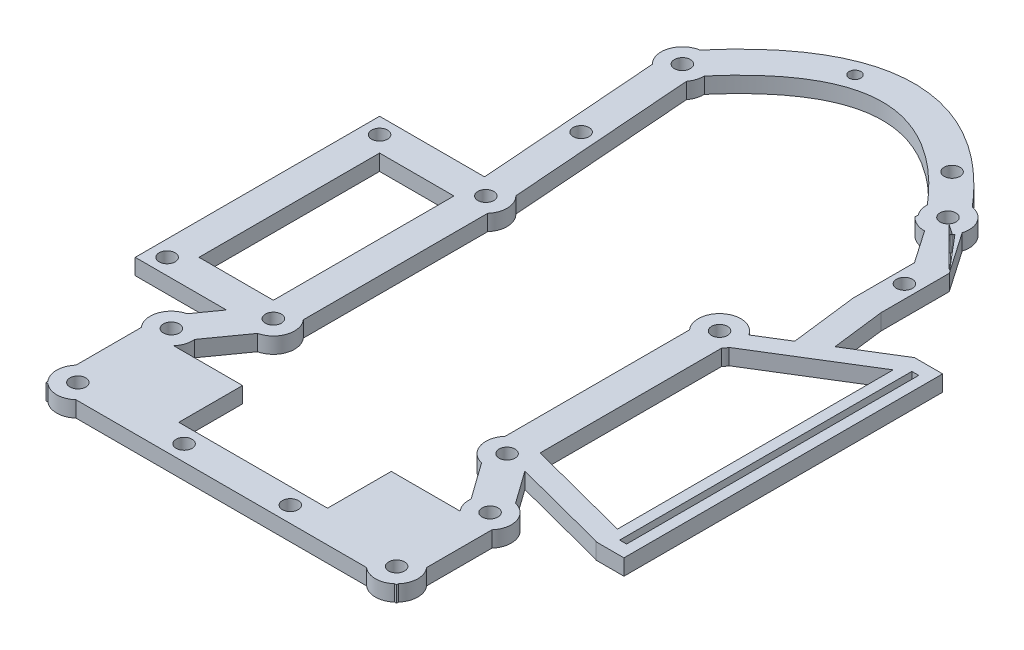
from build123d import *

# Parameters (mm, degrees)
SKETCH_1_W           = 80
SKETCH_1_H           = 120
SKETCH_1_R           = 1.5
EXTRUDE_1_DEPTH      = 3
SKETCH_2_W           = 10
SKETCH_2_H           = 60
SKETCH_2_W_2         = 1.3
SKETCH_2_H_2         = 55
EXTRUDE_2_DEPTH      = 3
CUT_EXTRUDE_1_DEPTH  = 126.435242257
EXTRUDE_4_DEPTH      = 3
EXTRUDE_START        = -3
EXTRUDE_7_DEPTH      = 3
CUT_EXTRUDE_5_DEPTH  = 124.421392121
SKETCH_20_W          = 13
SKETCH_20_H          = 12
EXTRUDE_8_DEPTH      = 3
CUT_EXTRUDE_6_DEPTH  = 124.421392121
SKETCH_23_R          = 1.5
EXTRUDE_9_DEPTH      = 3
SKETCH_24_R          = 1.5
CUT_EXTRUDE_7_DEPTH  = 124.421392121
SKETCH_25_R          = 1.5
CUT_EXTRUDE_8_DEPTH  = 124.421392121
SKETCH_26_R          = 1.5
CUT_EXTRUDE_9_DEPTH  = 124.421392121
SKETCH_27_R          = 1.1
CUT_EXTRUDE_10_DEPTH = 124.421392121


# Read off the part's stored shape, not the designer's step: 凸台-拉伸7
with BuildPart() as part:
    # 草图1 → 凸台-拉伸1 (new body)
    with BuildSketch(Plane(origin=(0, 0, 0), x_dir=(1, 0, 0), z_dir=(0, 1, 0))):
        with Locations((0, -55)):
            Rectangle(SKETCH_1_W, SKETCH_1_H)
        with Locations(Location((-25, 0, 0), (0, 0, 270))):
            Circle(SKETCH_1_R, mode=Mode.SUBTRACT)
        with Locations(Location((25, 0, 0), (0, 0, 270))):
            Circle(SKETCH_1_R, mode=Mode.SUBTRACT)
        with Locations(Location((-30, -91.2, 0), (0, 0, 270))):
            Circle(SKETCH_1_R, mode=Mode.SUBTRACT)
        with Locations(Location((-30, -108.8, 0), (0, 0, 270))):
            Circle(SKETCH_1_R, mode=Mode.SUBTRACT)
        with Locations(Location((30, -108.8, 0), (0, 0, 270))):
            Circle(SKETCH_1_R, mode=Mode.SUBTRACT)
        with Locations(Location((30, -91.2, 0), (0, 0, 270))):
            Circle(SKETCH_1_R, mode=Mode.SUBTRACT)
        with Locations(Location((-22, -40, 0), (0, 0, 270))):
            Circle(SKETCH_1_R, mode=Mode.SUBTRACT)
        with Locations(Location((-22, -80, 0), (0, 0, 270))):
            Circle(SKETCH_1_R, mode=Mode.SUBTRACT)
        with Locations(Location((22, -40, 0), (0, 0, 270))):
            Circle(SKETCH_1_R, mode=Mode.SUBTRACT)
        with Locations(Location((22, -80, 0), (0, 0, 270))):
            Circle(SKETCH_1_R, mode=Mode.SUBTRACT)
    extrude(amount=EXTRUDE_1_DEPTH)

    # 草图2 → 凸台-拉伸2 (add)
    with BuildSketch(Plane(origin=(0, 3, 0), x_dir=(1, 0, 0), z_dir=(0, 1, 0))):
        with Locations((45, -56)):
            Rectangle(SKETCH_2_W, SKETCH_2_H)
        with Locations((47.35, -56)):
            Rectangle(SKETCH_2_W_2, SKETCH_2_H_2, mode=Mode.SUBTRACT)
    extrude(amount=-EXTRUDE_2_DEPTH)

    # 草图6 → 切除-拉伸1 (cut, through all)
    with BuildSketch(Plane(origin=(0, 3, 0), x_dir=(1, 0, 0), z_dir=(0, 1, 0))):
        with BuildLine():
            Line((-25.189473533, -37.586028463), (-27.793722326, -2.862711226))
            ThreePointArc((-27.793722326, -2.862711226), (-26.553240274, 3.686115117), (-21, 0))
            ThreePointArc((-21, 0), (-21.20804179, -1.27320577), (-21.810526467, -2.413971537))
            Line((-21.810526467, -2.413971537), (-19.206277674, -37.137288774))
            ThreePointArc((-19.206277674, -37.137288774), (-18.313884883, -38.446759726), (-18, -40))
            ThreePointArc((-18, -40), (-18.258342613, -41.414213562), (-19, -42.645751311))
            Line((-19, -42.645751311), (-19, -77.354248689))
            ThreePointArc((-19, -77.354248689), (-18.258342613, -78.585786438), (-18, -80))
            ThreePointArc((-18, -80), (-18.868422538, -82.488618613), (-21.096611299, -83.896650979))
            Line((-21.096611299, -83.896650979), (-26.020987873, -90.790778183))
            ThreePointArc((-26.020987873, -90.790778183), (-26.005250414, -90.995120165), (-26, -91.2))
            ThreePointArc((-26, -91.2), (-26.258342613, -92.614213562), (-27, -93.845751311))
            Line((-27, -93.845751311), (-27, -105.8))
            Line((-27, -105.8), (27, -105.8))
            Line((27, -105.8), (27, -93.845751311))
            ThreePointArc((27, -93.845751311), (26.190817966, -92.420709724), (26.020987873, -90.790778183))
            Line((26.020987873, -90.790778183), (21.096611299, -83.896650979))
            ThreePointArc((21.096611299, -83.896650979), (18.190817966, -81.220709724), (19, -77.354248689))
            Line((19, -77.354248689), (19, -42.645751311))
            ThreePointArc((19, -42.645751311), (18.002801671, -39.850315262), (19.206277674, -37.137288774))
            Line((19.206277674, -37.137288774), (21.810526467, -2.413971537))
            ThreePointArc((21.810526467, -2.413971537), (23.72679423, 3.79195821), (29, 0))
            ThreePointArc((29, 0), (28.686115117, -1.553240274), (27.793722326, -2.862711226))
            Line((27.793722326, -2.862711226), (25.189473533, -37.586028463))
            ThreePointArc((25.189473533, -37.586028463), (25.300764223, -37.740585133), (25.404571796, -37.900264091))
            Line((25.404571796, -37.900264091), (44.7, -26))
            Line((44.7, -26), (40, -26))
            Line((40, -26), (40, 5))
            Line((40, 5), (-40, 5))
            Line((-40, 5), (-40, -115))
            Line((-40, -115), (40, -115))
            Line((40, -115), (40, -86))
            Line((40, -86), (44.7, -86))
            Line((44.7, -86), (44.7, -85.92173913))
            Line((44.7, -85.92173913), (26.530995751, -81.181998892))
            Line((26.530995751, -81.181998892), (30.903388701, -87.303349021))
            ThreePointArc((30.903388701, -87.303349021), (33.131577462, -88.711381387), (34, -91.2))
            ThreePointArc((34, -91.2), (33.741657387, -92.614213562), (33, -93.845751311))
            Line((33, -93.845751311), (33, -106.154248689))
            ThreePointArc((33, -106.154248689), (33.741657387, -107.385786438), (34, -108.8))
            ThreePointArc((34, -108.8), (33.741657387, -110.214213562), (33, -111.445751311))
            Line((33, -111.445751311), (33, -111.8))
            Line((33, -111.8), (32.645751311, -111.8))
            ThreePointArc((32.645751311, -111.8), (30, -112.8), (27.354248689, -111.8))
            Line((27.354248689, -111.8), (-27.354248689, -111.8))
            ThreePointArc((-27.354248689, -111.8), (-30, -112.8), (-32.645751311, -111.8))
            Line((-32.645751311, -111.8), (-33, -111.8))
            Line((-33, -111.8), (-33, -111.445751311))
            ThreePointArc((-33, -111.445751311), (-34, -108.8), (-33, -106.154248689))
            Line((-33, -106.154248689), (-33, -93.845751311))
            ThreePointArc((-33, -93.845751311), (-33.809182034, -89.979290276), (-30.903388701, -87.303349021))
            Line((-30.903388701, -87.303349021), (-25.979012127, -80.409221817))
            ThreePointArc((-25.979012127, -80.409221817), (-25.809182034, -78.779290276), (-25, -77.354248689))
            Line((-25, -77.354248689), (-25, -42.645751311))
            ThreePointArc((-25, -42.645751311), (-25.997198329, -40.149684738), (-25.189473533, -37.586028463))
        make_face()
        with BuildLine():
            Line((25, -76.782608696), (44.7, -81.92173913))
            Line((44.7, -81.92173913), (44.7, -30))
            Line((44.7, -30), (25.574350827, -41.795554556))
            ThreePointArc((25.574350827, -41.795554556), (25.31454836, -42.239144741), (25, -42.645751311))
            Line((25, -42.645751311), (25, -76.782608696))
        make_face()
    extrude(amount=-CUT_EXTRUDE_1_DEPTH, mode=Mode.SUBTRACT)

    # 草图8 → 凸台-拉伸4 (add)
    with BuildSketch(Plane(origin=(0, 3, 0), x_dir=(1, 0, 0), z_dir=(0, 1, 0))):
        with BuildLine():
            ThreePointArc((21.001994681, 0.126307052), (22.453984731, 3.085094204), (25.63451173, 3.949353727))
            add(Edge.make_bspline(
                [(-25.63451173, 3.949353727), (-21.616035979, 8.660307293), (-14.12462472, 14.545430623), (-7.175762049, 17.826043655), (0, 18.957143354), (7.175762049, 17.826043655), (14.12462472, 14.545430623), (21.616035979, 8.660307293), (25.63451173, 3.949353727)],
                knots=[0.032998994, 0.032998994, 0.032998994, 0.1875, 0.3125, 0.4375, 0.5625, 0.6875, 0.8125, 0.967001006, 0.967001006, 0.967001006], degree=2))
            ThreePointArc((-25.63451173, 3.949353727), (-22.453984731, 3.085094204), (-21.001994681, 0.126307052))
            add(Edge.make_bspline(
                [(-21.001994681, 0.126307052), (-17.328264465, 4.412597994), (-10.87537528, 9.455946034), (-5.324237951, 12.053221163), (0, 12.881417518), (5.324237951, 12.053221163), (10.87537528, 9.455946034), (17.328264465, 4.412597994), (21.001994681, 0.126307052)],
                knots=[0.034324579, 0.034324579, 0.034324579, 0.1875, 0.3125, 0.4375, 0.5625, 0.6875, 0.8125, 0.965675421, 0.965675421, 0.965675421], degree=2))
        make_face()
    extrude(amount=-EXTRUDE_4_DEPTH)

    # 凸台-拉伸7 outline → 凸台-拉伸7 (add)
    with BuildSketch(Plane.XZ.offset(EXTRUDE_START)):
        with BuildLine():
            ThreePointArc((27.793720423, 2.862736604), (28.42096157, 2.072958417), (28.83072097, 1.151395464))
            Line((28.83072097, 1.151395464), (34.223691018, 8.972202338))
            Line((34.223691018, 8.972202338), (34.223691018, 21.806543087))
            Line((34.223691018, 21.806543087), (35.438742218, 31.711788941))
            Line((35.438742218, 31.711788941), (30.755565173, 34.600091964))
            Line((30.755565173, 34.600091964), (29.223691018, 22.112066665))
            Line((29.223691018, 22.112066665), (29.223691018, 10.528995876))
            Line((29.223691018, 10.528995876), (27.415425056, 7.906674828))
            Line((27.415425056, 7.906674828), (27.793720423, 2.862736604))
        make_face()
    extrude(amount=EXTRUDE_7_DEPTH)

    # 草图17 → 切除-拉伸5 (cut, through all)
    with BuildSketch(Plane.XZ):
        with BuildLine():
            Line((25, 4.403860476), (27.415425056, 7.906674828))
            Line((27.415425056, 7.906674828), (25.189473533, 37.586028463))
            ThreePointArc((25.189473533, 37.586028463), (22.299159793, 36.01120276), (19.206277674, 37.137288774))
            Line((19.206277674, 37.137288774), (21.767281468, 2.990571516))
            ThreePointArc((21.767281468, 2.990571516), (23.235924124, 4.035098933), (25, 4.403860476))
        make_face()
    extrude(amount=-CUT_EXTRUDE_5_DEPTH, mode=Mode.SUBTRACT)

    # 草图20 → 凸台-拉伸8 (add)
    with BuildSketch(Plane(origin=(0, 0, 0), x_dir=(-1, 0, 0), z_dir=(0, -1, 0))):
        with Locations((20.5, -99.8)):
            Rectangle(SKETCH_20_W, SKETCH_20_H)
        with Locations((-20.5, -99.8)):
            Rectangle(SKETCH_20_W, SKETCH_20_H)
    extrude(amount=-EXTRUDE_8_DEPTH)

    # 草图22 → 切除-拉伸6 (cut, through all)
    with BuildSketch(Plane(origin=(0, 3, 0), x_dir=(1, 0, 0), z_dir=(0, 1, 0))):
        with BuildLine():
            ThreePointArc((-6.4, 15.3), (-7, 15.5), (-7.6, 15.3))
            ThreePointArc((-7.6, 15.3), (-7.447213595, 13.605572809), (-6, 14.5))
            ThreePointArc((-6, 14.5), (-6.105572809, 14.947213595), (-6.4, 15.3))
        make_face()
    extrude(amount=-CUT_EXTRUDE_6_DEPTH, mode=Mode.SUBTRACT)

    # 草图23 → 凸台-拉伸9 (add)
    with BuildSketch(Plane(origin=(0, 3, 0), x_dir=(1, 0, 0), z_dir=(0, 1, 0))):
        with BuildLine():
            Line((-25.189473533, -37.586028463), (-25.233425668, -37))
            Line((-25.233425668, -37), (-45, -37))
            Line((-45, -37), (-45, -83))
            Line((-45, -83), (-27.829567972, -83))
            Line((-27.829567972, -83), (-25.979012127, -80.409221817))
            ThreePointArc((-25.979012127, -80.409221817), (-25.809182034, -78.779290276), (-25, -77.354248689))
            Line((-25, -77.354248689), (-25, -77))
            Line((-25, -77), (-39, -77))
            Line((-39, -77), (-39, -43))
            Line((-39, -43), (-25, -43))
            Line((-25, -43), (-25, -42.645751311))
            ThreePointArc((-25, -42.645751311), (-25.997198329, -40.149684738), (-25.189473533, -37.586028463))
        make_face()
        with Locations(Location((-42, -80, 0), (0, 0, 270))):
            Circle(SKETCH_23_R, mode=Mode.SUBTRACT)
        with Locations(Location((-42, -40, 0), (0, 0, 270))):
            Circle(SKETCH_23_R, mode=Mode.SUBTRACT)
    extrude(amount=-EXTRUDE_9_DEPTH)

    # 草图24 → 切除-拉伸7 (cut, through all)
    with BuildSketch(Plane(origin=(0, 3, 0), x_dir=(1, 0, 0), z_dir=(0, 1, 0))):
        with Locations(Location((31.723691018, -14.919604311, 0), (0, 0, 270))):
            Circle(SKETCH_24_R)
    extrude(amount=-CUT_EXTRUDE_7_DEPTH, mode=Mode.SUBTRACT)

    # 草图25 → 切除-拉伸8 (cut, through all)
    with BuildSketch(Plane(origin=(0, 3, 0), x_dir=(1, 0, 0), z_dir=(0, 1, 0))):
        with Locations(Location((-10, -108.8, 0), (0, 0, 270))):
            Circle(SKETCH_25_R)
        with Locations(Location((10, -108.8, 0), (0, 0, 270))):
            Circle(SKETCH_25_R)
    extrude(amount=-CUT_EXTRUDE_8_DEPTH, mode=Mode.SUBTRACT)

    # 草图26 → 切除-拉伸9 (cut, through all)
    with BuildSketch(Plane(origin=(0, 3, 0), x_dir=(1, 0, 0), z_dir=(0, 1, 0))):
        with Locations(Location((-23.454051506, -20.612646593, 0), (0, 0, 270))):
            Circle(SKETCH_26_R)
        with Locations(Location((17.945879734, 7.826478982, 0), (0, 0, 270))):
            Circle(SKETCH_26_R)
    extrude(amount=-CUT_EXTRUDE_9_DEPTH, mode=Mode.SUBTRACT)

    # 草图27 → 切除-拉伸10 (cut, through all)
    with BuildSketch(Plane(origin=(0, 3, 0), x_dir=(1, 0, 0), z_dir=(0, 1, 0))):
        with Locations(Location((-7, 14.5, 0), (0, 0, 270))):
            Circle(SKETCH_27_R)
    extrude(amount=-CUT_EXTRUDE_10_DEPTH, mode=Mode.SUBTRACT)


solid = part.part
